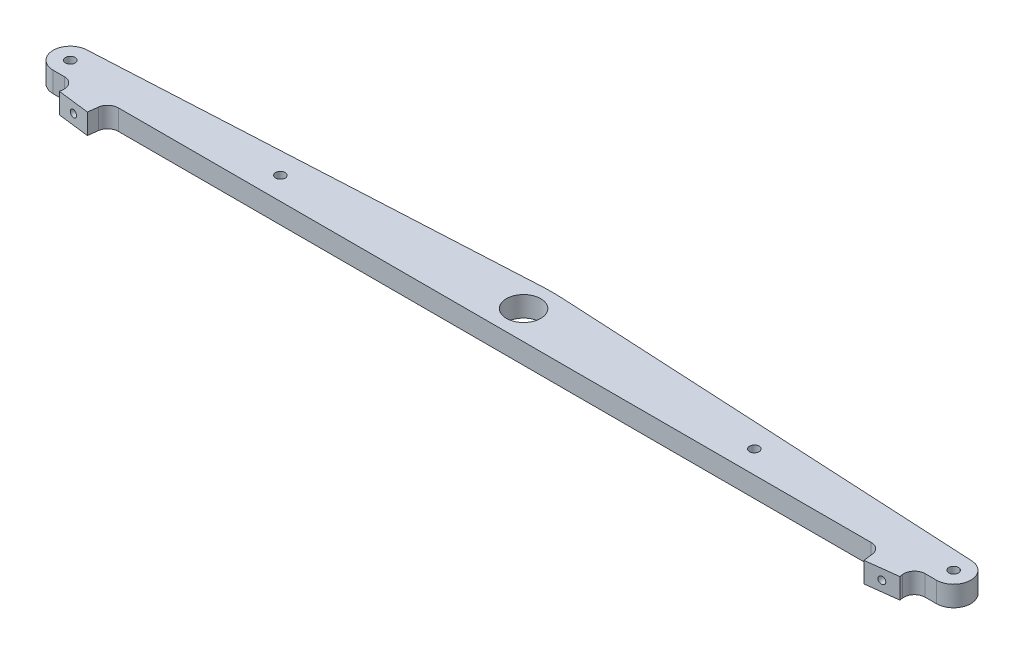
from build123d import *

# Parameters (mm, degrees)
STOCK_UOR22_CNS_5_P_007_SWING_ARM_PLATE_START = -3.175
STOCK_UOR22_CNS_5_P_007_SWING_ARM_PL_2_R      = 2.9
STOCK_UOR22_CNS_5_P_007_SWING_ARM_PL_2_R_2    = 2.25
STOCK_UOR22_CNS_5_P_007_SWING_ARM_PL_2_R_3    = 8
STOCK_UOR22_CNS_5_P_007_SWING_ARM_PLATE_DEPTH = 3.175
BOSS_EXTRUDE2_DEPTH                           = 9.525
SKETCH5_R                                     = 8
CUT_EXTRUDE1_DEPTH                            = 235.085039959
SKETCH7_R                                     = 2.25
CUT_EXTRUDE3_DEPTH                            = 235.085039959
CUT_EXTRUDE2_DEPTH                            = 235.085039959
BOSS_EXTRUDE5_DEPTH                           = 9.525
M4_TAPPED_HOLE1_D                             = 3.3
FILLET4_R                                     = 5
FILLET4_OF_MIRROR7_R                          = 5


# Read off the part's stored shape, not the designer's step: Stock-UOR22-CNS-5-P-007_Swing_arm_plate-1
with BuildPart() as part:
    # Stock-UOR22-CNS-5-P-007_Swing_arm_pl 2 → Stock-UOR22-CNS-5-P-007_Swing_arm_plate-1 (new body)
    with BuildSketch(Plane(origin=(0, 0, 0), x_dir=(1, 0, 0), z_dir=(0, 1, 0)).offset(STOCK_UOR22_CNS_5_P_007_SWING_ARM_PLATE_START)):
        with BuildLine():
            ThreePointArc((226, -13.432371654), (233.502570944, -6.12369062), (226.392788824, 1.567628346))
            Line((226.392788824, 1.567628346), (5.233595624, 13.15809053))
            ThreePointArc((5.233595624, 13.15809053), (0, 13.295137054), (-5.233595624, 13.15809053))
            Line((-5.233595624, 13.15809053), (-226.392788824, 1.567628346))
            ThreePointArc((-226.392788824, 1.567628346), (-233.502570944, -6.12369062), (-226, -13.432371654))
            Line((-226, -13.432371654), (226, -13.432371654))
        make_face()
        with Locations((-226, -5.927228885)):
            Circle(STOCK_UOR22_CNS_5_P_007_SWING_ARM_PL_2_R, mode=Mode.SUBTRACT)
        with Locations((-206, -5.40297223)):
            Circle(STOCK_UOR22_CNS_5_P_007_SWING_ARM_PL_2_R_2, mode=Mode.SUBTRACT)
        with BuildLine():
            ThreePointArc((-200.009372106, -5.067744788), (-199.5011525, -3.620374273), (-198.117168054, -2.958743238))
            Line((-198.117168054, -2.958743238), (-118.332872644, 1.222574507))
            ThreePointArc((-118.332872644, 1.222574507), (-116.669449692, 0.478429636), (-116.300073603, -1.306027932))
            ThreePointArc((-116.300073603, -1.306027932), (-116.513571396, -3.059574073), (-116.207168794, -4.799293251))
            ThreePointArc((-116.207168794, -4.799293251), (-116.481651343, -6.601525877), (-118.104327652, -7.432371654))
            Line((-118.104327652, -7.432371654), (-198.000054021, -7.432371654))
            ThreePointArc((-198.000054021, -7.432371654), (-199.416863766, -6.843984258), (-200.000040515, -5.425021798))
            ThreePointArc((-200.000040515, -5.425021798), (-200.002045504, -5.246313796), (-200.009372106, -5.067744788))
        make_face(mode=Mode.SUBTRACT)
        with Locations((-110.515692218, -2.900058041)):
            Circle(STOCK_UOR22_CNS_5_P_007_SWING_ARM_PL_2_R_2, mode=Mode.SUBTRACT)
        with BuildLine():
            ThreePointArc((-15.423577727, 6.615822121), (-13.745275303, 5.852940228), (-13.404042587, 4.04124267))
            ThreePointArc((-13.404042587, 4.04124267), (-13.994975846, -0.375034774), (-13.168367384, -4.753325197))
            ThreePointArc((-13.168367384, -4.753325197), (-13.412783431, -6.581699085), (-15.049562725, -7.432371654))
            Line((-15.049562725, -7.432371654), (-102.927056783, -7.432371654))
            ThreePointArc((-102.927056783, -7.432371654), (-104.549733092, -6.601525877), (-104.824215641, -4.799293251))
            ThreePointArc((-104.824215641, -4.799293251), (-104.5176845, -2.745450719), (-104.929619796, -0.710127699))
            ThreePointArc((-104.929619796, -0.710127699), (-104.748793796, 1.103164739), (-103.172267568, 2.017108151))
            Line((-103.172267568, 2.017108151), (-15.423577727, 6.615822121))
        make_face(mode=Mode.SUBTRACT)
        with Locations((110.515692218, -2.900058041)):
            Circle(STOCK_UOR22_CNS_5_P_007_SWING_ARM_PL_2_R_2, mode=Mode.SUBTRACT)
        with BuildLine():
            Line((15.423577727, 6.615822121), (103.172267568, 2.017108151))
            ThreePointArc((103.172267568, 2.017108151), (104.748793796, 1.103164739), (104.929619796, -0.710127699))
            ThreePointArc((104.929619796, -0.710127699), (104.5176845, -2.745450719), (104.824215641, -4.799293251))
            ThreePointArc((104.824215641, -4.799293251), (104.549733092, -6.601525877), (102.927056783, -7.432371654))
            Line((102.927056783, -7.432371654), (15.049562725, -7.432371654))
            ThreePointArc((15.049562725, -7.432371654), (13.412783431, -6.581699085), (13.168367384, -4.753325197))
            ThreePointArc((13.168367384, -4.753325197), (13.994975846, -0.375034774), (13.404042587, 4.04124267))
            ThreePointArc((13.404042587, 4.04124267), (13.745275303, 5.852940228), (15.423577727, 6.615822121))
        make_face(mode=Mode.SUBTRACT)
        with Locations((226, -5.927228885)):
            Circle(STOCK_UOR22_CNS_5_P_007_SWING_ARM_PL_2_R, mode=Mode.SUBTRACT)
        with Locations((206, -5.40297223)):
            Circle(STOCK_UOR22_CNS_5_P_007_SWING_ARM_PL_2_R_2, mode=Mode.SUBTRACT)
        with BuildLine():
            Line((118.332872644, 1.222574507), (198.117168054, -2.958743238))
            ThreePointArc((198.117168054, -2.958743238), (199.5011525, -3.620374273), (200.009372106, -5.067744788))
            ThreePointArc((200.009372106, -5.067744788), (200.002045504, -5.246313796), (200.000040515, -5.425021798))
            ThreePointArc((200.000040515, -5.425021798), (199.416863766, -6.843984258), (198.000054021, -7.432371654))
            Line((198.000054021, -7.432371654), (118.104327652, -7.432371654))
            ThreePointArc((118.104327652, -7.432371654), (116.481651343, -6.601525877), (116.207168794, -4.799293251))
            ThreePointArc((116.207168794, -4.799293251), (116.513571396, -3.059574073), (116.300073603, -1.306027932))
            ThreePointArc((116.300073603, -1.306027932), (116.669449692, 0.478429636), (118.332872644, 1.222574507))
        make_face(mode=Mode.SUBTRACT)
        Circle(STOCK_UOR22_CNS_5_P_007_SWING_ARM_PL_2_R_3, mode=Mode.SUBTRACT)
    extrude(amount=STOCK_UOR22_CNS_5_P_007_SWING_ARM_PLATE_DEPTH)


with BuildPart() as body_2:
    # Sketch3 → Boss-Extrude2 (new body)
    with BuildSketch(Plane(origin=(0, 0, 0), x_dir=(1, 0, 0), z_dir=(0, 1, 0))):
        with BuildLine():
            Line((226.392788824, 1.567628346), (5.233595624, 13.15809053))
            ThreePointArc((5.233595624, 13.15809053), (0, 13.295137054), (-5.233595624, 13.15809053))
            Line((-5.233595624, 13.15809053), (-226.392788824, 1.567628346))
            ThreePointArc((-226.392788824, 1.567628346), (-233.502570944, -6.12369062), (-226, -13.432371654))
            Line((-226, -13.432371654), (226, -13.432371654))
            ThreePointArc((226, -13.432371654), (233.502570944, -6.12369062), (226.392788824, 1.567628346))
        make_face()
    extrude(amount=BOSS_EXTRUDE2_DEPTH)

    # Sketch5 → Cut-Extrude1 (cut, through all)
    with BuildSketch(Plane.XZ):
        with Locations(Location((0, 0, 0), (0, 0, 270))):
            Circle(SKETCH5_R)
    extrude(amount=-CUT_EXTRUDE1_DEPTH, mode=Mode.SUBTRACT)

    # Sketch7 → Cut-Extrude3 (cut, through all)
    with BuildSketch(Plane.XZ):
        with Locations(Location((-206, 5.40297223, 0), (0, 0, 270))):
            Circle(SKETCH7_R)
        with Locations(Location((-110.515692218, 2.900058041, 0), (0, 0, 270))):
            Circle(SKETCH7_R)
    cut_extrude3 = extrude(amount=-CUT_EXTRUDE3_DEPTH, mode=Mode.SUBTRACT)

    # Sketch6 → Cut-Extrude2 (cut, through all)
    with BuildSketch(Plane.XZ):
        with BuildLine():
            Line((-226.392788824, -1.567628346), (-206.420198128, -2.614347471))
            ThreePointArc((-206.420198128, -2.614347471), (-214.02610991, 5.613681539), (-206, 13.432371654))
            Line((-206, 13.432371654), (-226, 13.432371654))
            ThreePointArc((-226, 13.432371654), (-233.502570944, 6.12369062), (-226.392788824, -1.567628346))
        make_face()
    cut_extrude2 = extrude(amount=-CUT_EXTRUDE2_DEPTH, mode=Mode.SUBTRACT)

    # Mirror4: Cut-Extrude3, Cut-Extrude2 across plane
    add(cut_extrude3.mirror(Plane(origin=(0, 0, 0), x_dir=(0, 0, 1), z_dir=(1, 0, 0))), mode=Mode.SUBTRACT)
    add(cut_extrude2.mirror(Plane(origin=(0, 0, 0), x_dir=(0, 0, 1), z_dir=(1, 0, 0))), mode=Mode.SUBTRACT)

    # Sketch8 → Boss-Extrude5 (add)
    with BuildSketch(Plane(origin=(0, 9.525, 0), x_dir=(1, 0, 0), z_dir=(0, 1, 0))):
        Polygon((-180, -13.432371654), (-195.112647382, -13.432371654), (-195.982696315, -20.518351578), (-181.094504041, -22.34639173), align=None)
    boss_extrude5 = extrude(amount=-BOSS_EXTRUDE5_DEPTH)

    # M4 Tapped Hole1 (through all)
    with Locations(Plane(origin=(-5.392681082, 0, 43.919862911), x_dir=(0.992546151641322, 0, 0.12186934340514761), z_dir=(-0.12186934340514761, 0, 0.992546151641322))):
        with Locations((-184.521312982, 4.7625)):
            m4_tapped_hole1 = Hole(M4_TAPPED_HOLE1_D / 2)

    # Fillet4
    fillet4_edges = [body_2.edges().sort_by_distance(p)[0] for p in [
        (-195.112647382, 4.7625, 13.432371654),
        (-180, 4.7625, 13.432371654),
    ]]
    fillet(fillet4_edges, radius=FILLET4_R)

    # Mirror7: Boss-Extrude5, M4 Tapped Hole1 across plane
    add(boss_extrude5.mirror(Plane(origin=(0, 0, 0), x_dir=(0, 0, 1), z_dir=(1, 0, 0))))
    add(m4_tapped_hole1.mirror(Plane(origin=(0, 0, 0), x_dir=(0, 0, 1), z_dir=(1, 0, 0))), mode=Mode.SUBTRACT)

    # Fillet4 of Mirror7
    fillet4_of_mirror7_edges = [body_2.edges().sort_by_distance(p)[0] for p in [
        (195.112647382, 4.7625, 13.432371654),
        (180, 4.7625, 13.432371654),
    ]]
    fillet(fillet4_of_mirror7_edges, radius=FILLET4_OF_MIRROR7_R)


solid = body_2.part
